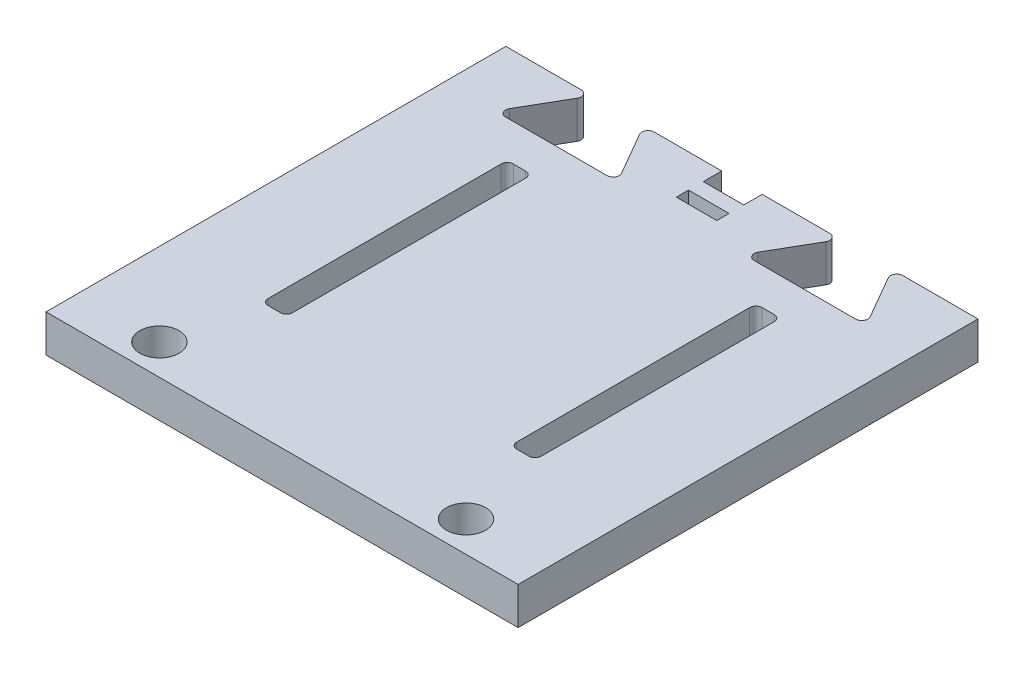
from build123d import *

# Parameters (mm, degrees)
BOSS_EXTRUDE1_DEPTH                = 3.05
FILLET3_R                          = 0.5
SKETCH2_W                          = 3.3
SKETCH2_H                          = 40
SKETCH2_H_2                        = 1
CUT_EXTRUDE1_DEPTH                 = 43.262453786
SKETCH6_W                          = 2
SKETCH6_H                          = 20
CUT_EXTRUDE2_DEPTH                 = 43.262453786
FILLET4_R                          = 0.5
M3_CLEARANCE_HEAD_MOUNTING_HOLES_D = 3.2


with BuildPart() as part:
    # Sketch1 → Boss-Extrude1 (new body)
    with BuildSketch(Plane(origin=(0, 0, 0), x_dir=(1, 0, 0), z_dir=(0, 1, 0))):
        Polygon((-19.25, 0), (-19.25, 37.5), (-12.25, 37.5), (-15.136751346, 32.5), (-5.136751346, 32.5), (-8.023502692, 37.5), (8.023502692, 37.5), (5.136751346, 32.5), (15.136751346, 32.5), (12.25, 37.5), (19.25, 37.5), (19.25, 0), align=None)
    extrude(amount=BOSS_EXTRUDE1_DEPTH)

    # Fillet3
    fillet3_edges = [part.edges().sort_by_distance(p)[0] for p in [
        (15.136751346, 1.525, -32.5),
        (12.25, 1.525, -37.5),
        (5.136751346, 1.525, -32.5),
        (8.023502692, 1.525, -37.5),
        (-8.023502692, 1.525, -37.5),
        (-5.136751346, 1.525, -32.5),
        (-15.136751346, 1.525, -32.5),
        (-12.25, 1.525, -37.5),
    ]]
    fillet(fillet3_edges, radius=FILLET3_R)

    # Sketch2 → Cut-Extrude1 (cut, through all)
    with BuildSketch(Plane(origin=(0, 3.05, 0), x_dir=(1, 0, 0), z_dir=(0, 1, 0))):
        with Locations((0, 56)):
            Rectangle(SKETCH2_W, SKETCH2_H)
        with Locations((0, 34.3)):
            Rectangle(SKETCH2_W, SKETCH2_H_2)
    extrude(amount=-CUT_EXTRUDE1_DEPTH, mode=Mode.SUBTRACT)

    # Sketch6 → Cut-Extrude2 (cut, through all)
    with BuildSketch(Plane(origin=(0, 3.05, 0), x_dir=(1, 0, 0), z_dir=(0, 1, 0))):
        with Locations((-10.136751346, 19.5)):
            Rectangle(SKETCH6_W, SKETCH6_H)
        with Locations((10.136751346, 19.5)):
            Rectangle(SKETCH6_W, SKETCH6_H)
    extrude(amount=-CUT_EXTRUDE2_DEPTH, mode=Mode.SUBTRACT)

    # Fillet4
    fillet4_edges = [part.edges().sort_by_distance(p)[0] for p in [
        (9.136751346, 1.525, -9.5),
        (11.136751346, 1.525, -9.5),
        (11.136751346, 1.525, -29.5),
        (9.136751346, 1.525, -29.5),
        (-11.136751346, 1.525, -9.5),
        (-9.136751346, 1.525, -9.5),
        (-9.136751346, 1.525, -29.5),
        (-11.136751346, 1.525, -29.5),
    ]]
    fillet(fillet4_edges, radius=FILLET4_R)

    # M3 Clearance Head Mounting Holes (through all)
    with Locations(Plane(origin=(0, 3.05, 0), x_dir=(1, 0, 0), z_dir=(0, 1, 0))):
        with Locations((-12.5, 2.5), (12.5, 2.5)):
            Hole(M3_CLEARANCE_HEAD_MOUNTING_HOLES_D / 2)


solid = part.part
